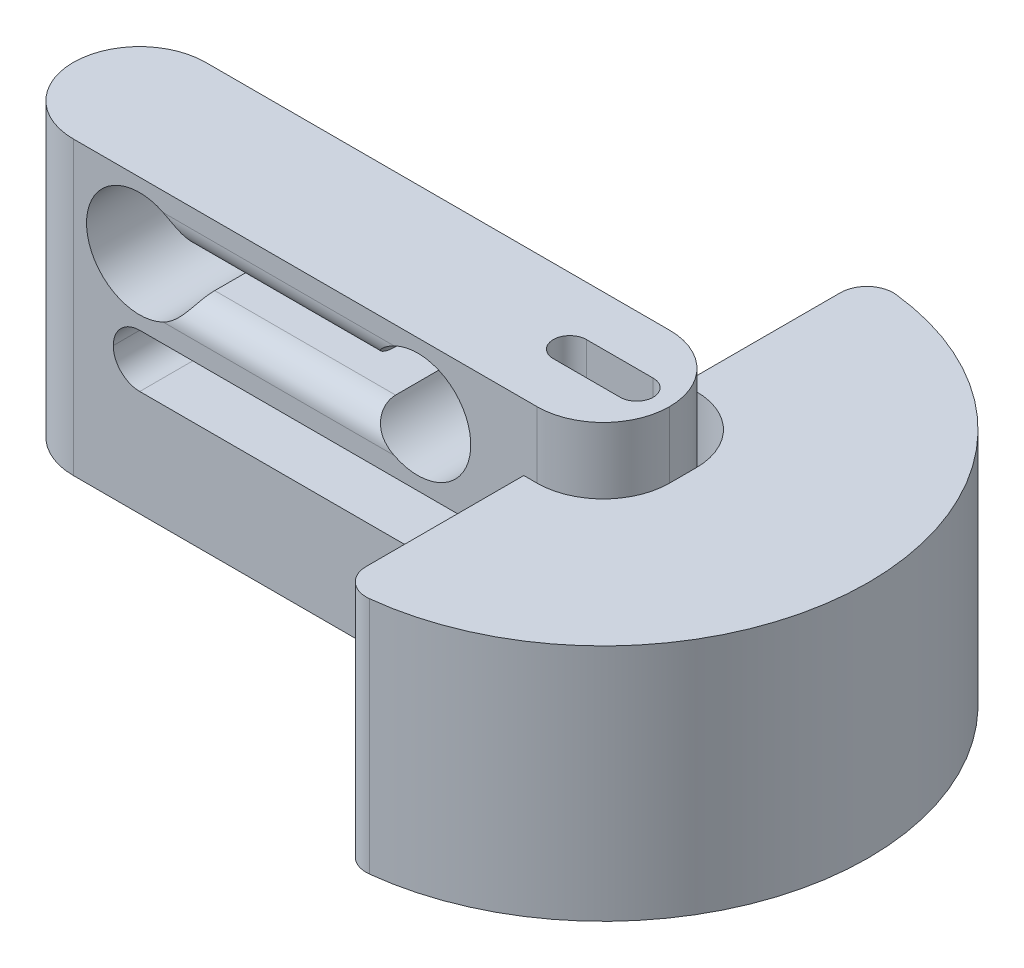
from build123d import *

# Parameters (mm, degrees)
BOSS_EXTRUDE1_DEPTH      = 5
BOSS_EXTRUDE1_DEPTH_BACK = 5
CUT_EXTRUDE1_DEPTH       = 5
BOSS_EXTRUDE2_START      = -14
SKETCH3_W                = 5.881583951
SKETCH3_H                = 10
BOSS_EXTRUDE2_DEPTH      = 8
BOSS_EXTRUDE3_START      = 10
BOSS_EXTRUDE3_DEPTH      = 10
FILLET2_R                = 5
FILLET3_R                = 2
SKETCH5_R                = 2
SKETCH5_W                = 3
SKETCH5_H                = 3
CUT_EXTRUDE2_DEPTH       = 4
FILLET4_R                = 1
SKETCH6_R                = 3.25
CUT_EXTRUDE3_DEPTH       = 5
BOSS_EXTRUDE4_START      = -14
SKETCH7_R                = 2
BOSS_EXTRUDE4_DEPTH      = 3.7
FILLET5_R                = 1.6


with BuildPart() as part:
    # Sketch1 → Boss-Extrude1 (new, two sides: drawn at the far end of the back side and taken through both)
    with BuildSketch(Plane.XY.offset(-BOSS_EXTRUDE1_DEPTH_BACK)):
        Polygon((5, -10), (5, 0), (0, 0), (-5, 0), (-35, 0), (-40, 0), (-40, -14), (-31.982625312, -14), (-31.982625312, -10), (-5, -10), align=None)
        with BuildLine():
            ThreePointArc((-26.324974154, -6.579298906), (-34, -5), (-26.324974154, -3.420701094))
            Line((-26.324974154, -3.420701094), (-12.675025846, -3.420701094))
            ThreePointArc((-12.675025846, -3.420701094), (-8.193806283, -1.082085798), (-5, -5))
            ThreePointArc((-5, -5), (-8.193806283, -8.917914202), (-12.675025846, -6.579298906))
            Line((-12.675025846, -6.579298906), (-26.324974154, -6.579298906))
        make_face(mode=Mode.SUBTRACT)
    extrude(amount=BOSS_EXTRUDE1_DEPTH + BOSS_EXTRUDE1_DEPTH_BACK)

    # Sketch2 → Cut-Extrude1 (cut)
    with BuildSketch(Plane(origin=(0, 0, 0), x_dir=(1, 0, 0), z_dir=(0, 1, 0))):
        with BuildLine():
            Line((-2.520975228, 1.25), (2.520975228, 1.25))
            ThreePointArc((2.520975228, 1.25), (3.770975228, 0), (2.520975228, -1.25))
            Line((2.520975228, -1.25), (-2.520975228, -1.25))
            ThreePointArc((-2.520975228, -1.25), (-3.770975228, 0), (-2.520975228, 1.25))
        make_face()
    extrude(amount=-CUT_EXTRUDE1_DEPTH, mode=Mode.SUBTRACT)

    # Sketch3 → Boss-Extrude2 (add)
    with BuildSketch(Plane(origin=(0, 0, 0), x_dir=(1, 0, 0), z_dir=(0, 1, 0)).offset(BOSS_EXTRUDE2_START)):
        with BuildLine():
            Line((0, 20), (0, 5))
            Line((0, 5), (5.881583951, 5))
            Line((5.881583951, 5), (5.881583951, -5))
            Line((5.881583951, -5), (0, -5))
            Line((0, -5), (0, -20))
            ThreePointArc((0, -20), (14.142135624, -14.142135624), (20, 0))
            ThreePointArc((20, 0), (14.142135624, 14.142135624), (0, 20))
        make_face()
        with Locations((2.940791976, 0)):
            Rectangle(SKETCH3_W, SKETCH3_H)
        with BuildLine():
            Line((0, 5), (-19.364916731, 5))
            ThreePointArc((-19.364916731, 5), (-20, 0), (-19.364916731, -5))
            Line((-19.364916731, -5), (0, -5))
            Line((0, -5), (0, 5))
        make_face()
        with BuildLine():
            Line((-19.364916731, 5), (-40, 5))
            Line((-40, 5), (-40, -5))
            Line((-40, -5), (-19.364916731, -5))
            ThreePointArc((-19.364916731, -5), (-20, 0), (-19.364916731, 5))
        make_face()
    extrude(amount=-BOSS_EXTRUDE2_DEPTH)

    # Sketch4 → Boss-Extrude3 (add)
    with BuildSketch(Plane(origin=(0, -14, 0), x_dir=(1, 0, 0), z_dir=(0, 1, 0)).offset(BOSS_EXTRUDE3_START)):
        with BuildLine():
            ThreePointArc((20, 0), (14.142135624, 14.142135624), (0, 20))
            Line((0, 20), (0, 6))
            Line((0, 6), (6, 6))
            Line((6, 6), (6, -6))
            Line((6, -6), (0, -6))
            Line((0, -6), (0, -20))
            ThreePointArc((0, -20), (14.142135624, -14.142135624), (20, 0))
        make_face()
    extrude(amount=-BOSS_EXTRUDE3_DEPTH)

    # Fillet2
    fillet2_edges = [part.edges().sort_by_distance(p)[0] for p in [
        (-40, -11, -5),
        (-40, -11, 5),
        (6, -9, 6),
        (6, -9, -6),
        (5, -5, 5),
        (5, -5, -5),
    ]]
    fillet(fillet2_edges, radius=FILLET2_R - 0.0001)  # a hair under: the kernel refuses the full size

    # Fillet3
    fillet3_edges = [part.edges().sort_by_distance(p)[0] for p in [
        (-19.5, -3.420701094, 5),
        (-19.5, -3.420701094, -5),
        (-19.5, -6.579298906, 5),
        (-19.5, -6.579298906, -5),
        (-31.982625312, -10, 0),
        (-31.982625312, -14, 0),
        (0, -13, -20),
        (0, -13, 20),
    ]]
    fillet(fillet3_edges, radius=FILLET3_R - 0.0001)  # a hair under: the kernel refuses the full size

    # Sketch5 → Cut-Extrude2 (cut)
    with BuildSketch(Plane.XZ.offset(22)):
        with Locations(Location((0, 0, 0), (0, 0, 270))):
            Circle(SKETCH5_R)
        with BuildLine():
            Line((-35, 3.25), (-12, 3.25))
            ThreePointArc((-12, 3.25), (-8.75, 0), (-12, -3.25))
            Line((-12, -3.25), (-35, -3.25))
            ThreePointArc((-35, -3.25), (-38.25, 0), (-35, 3.25))
        make_face()
        with Locations((-5, 0)):
            Rectangle(SKETCH5_W, SKETCH5_H)
        with Locations((5, 0)):
            Rectangle(SKETCH5_W, SKETCH5_H)
    extrude(amount=-CUT_EXTRUDE2_DEPTH, mode=Mode.SUBTRACT)

    # Fillet4
    fillet4_edges = [part.edges().sort_by_distance(p)[0] for p in [
        (-23.5, -18, 3.25),
        (-8.75, -18, 0),
        (-23.5, -18, -3.25),
        (-38.25, -18, 0),
        (0, -18, -5),
        (0, -18, 5),
        (0, -22, 2),
    ]]
    fillet(fillet4_edges, radius=FILLET4_R)

    # Sketch6 → Cut-Extrude3 (cut)
    with BuildSketch(Plane.XZ.offset(22)):
        with Locations(Location((-35, 0, 0), (0, 0, 270))):
            Circle(SKETCH6_R)
    extrude(amount=-CUT_EXTRUDE3_DEPTH, mode=Mode.SUBTRACT)

    # Sketch7 → Boss-Extrude4 (add)
    with BuildSketch(Plane(origin=(0, 0, 0), x_dir=(1, 0, 0), z_dir=(0, 1, 0)).offset(BOSS_EXTRUDE4_START)):
        with Locations(Location((0, 0, 0), (0, 0, 90))):
            Circle(SKETCH7_R)
    extrude(amount=BOSS_EXTRUDE4_DEPTH)

    # Fillet5
    fillet5_edges = [part.edges().sort_by_distance(p)[0] for p in [
        (0, -14, 2),
        (0, -10.3, 2),
    ]]
    fillet(fillet5_edges, radius=FILLET5_R)


solid = part.part
